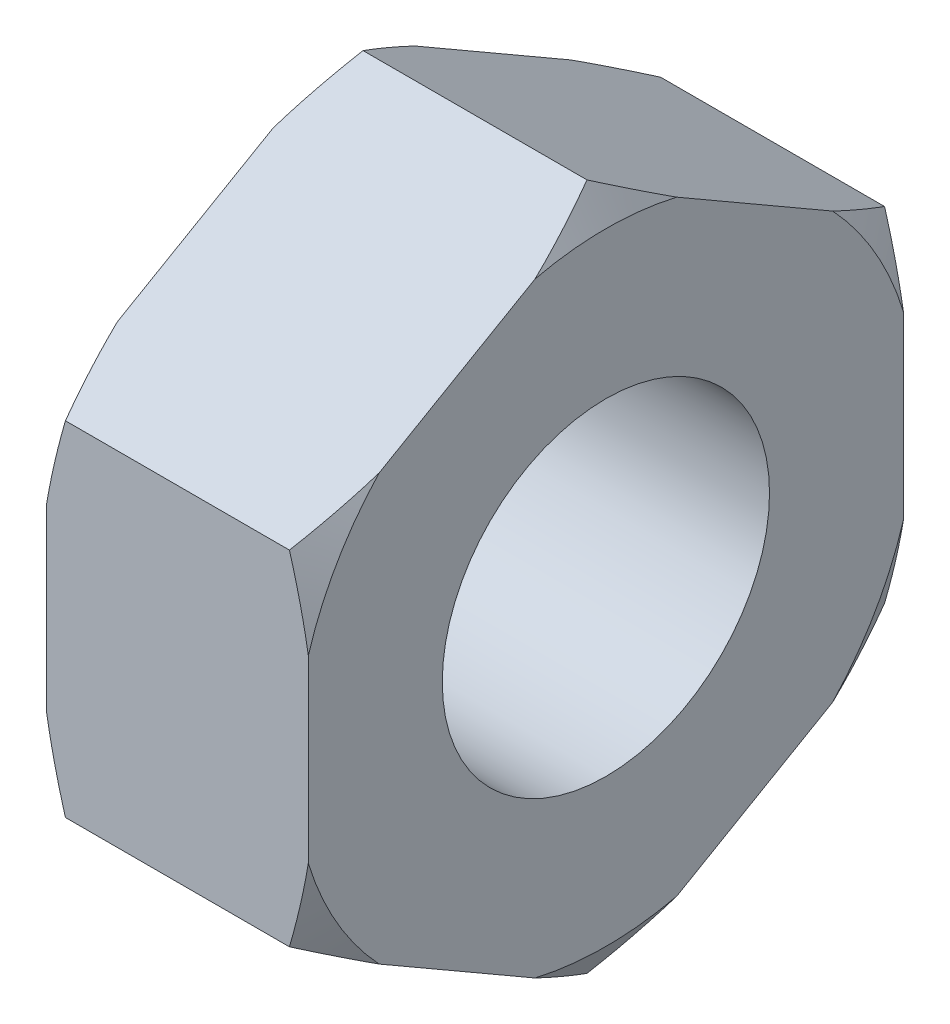
from build123d import *

# Parameters (mm, degrees)
SKETCH_3_OUTSIDE_W  = 7.43
SKETCH_3_OUTSIDE_H  = 7.43
CUT_EXTRUDE_4_DEPTH = 10


with BuildPart() as part:
    # Эскиз1 → Повернуть1 (revolve)
    with BuildSketch(Plane.XY):
        Polygon((-0.496091837, 1), (1.103908163, 1), (1.103908163, 1.9), (0.988438109, 2.1), (-0.380621783, 2.1), (-0.496091837, 1.9), align=None)
    revolve(axis=Axis((-3.876264999, 0, 0), (1, 0, 0)))

    # Эскиз3 outside → Вырез-Вытянуть4 (cut)
    with BuildSketch(Plane.ZY.offset(0.496091837)):
        Rectangle(SKETCH_3_OUTSIDE_W, SKETCH_3_OUTSIDE_H)
        Polygon((0, 2.1), (-1.818653348, 1.05), (-1.818653348, -1.05), (0, -2.1), (1.818653348, -1.05), (1.818653348, 1.05), align=None, mode=Mode.SUBTRACT)
    extrude(amount=-CUT_EXTRUDE_4_DEPTH, mode=Mode.SUBTRACT)


solid = part.part
